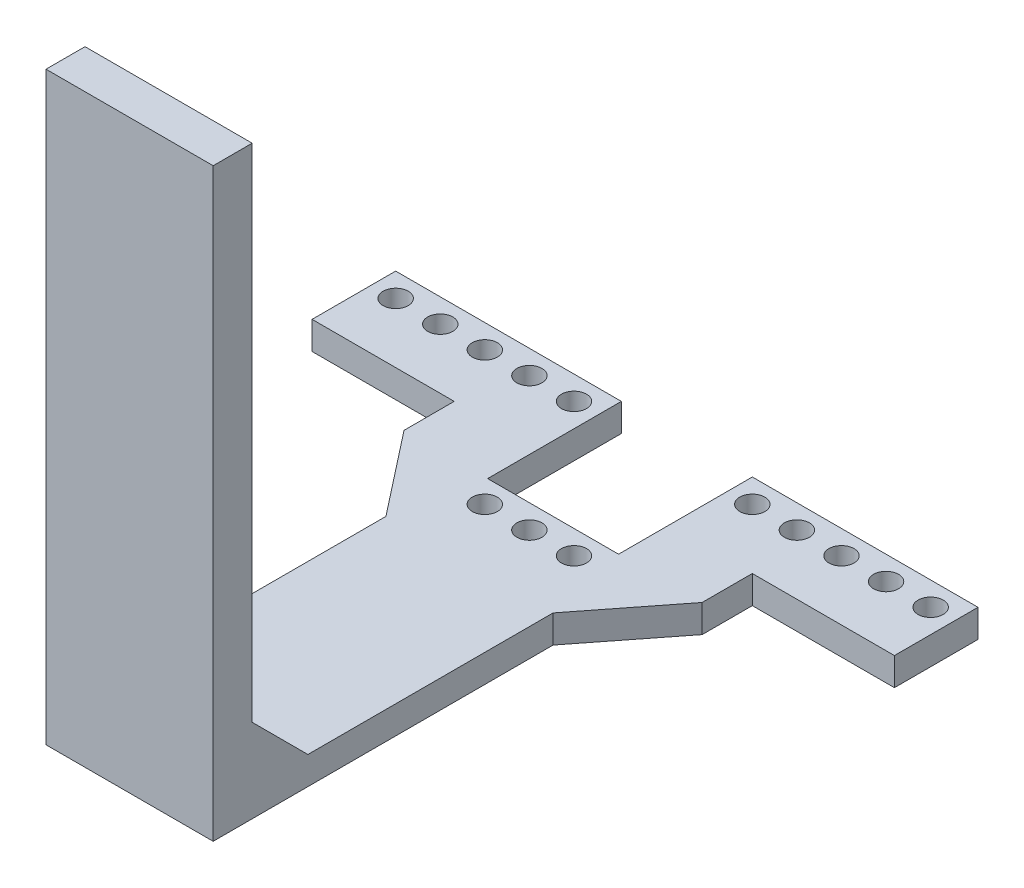
from build123d import *

# Parameters (mm, degrees)
SKETCH_2_R      = 2.25
EXTRUDE_1_DEPTH = 5
SKETCH_9_W      = 30
SKETCH_9_H      = 7
EXTRUDE_8_DEPTH = 100
CHAMFER_1_SIZE  = 10


with BuildPart() as part:
    # 草图2 → 凸台-拉伸1 (new body)
    with BuildSketch(Plane(origin=(0, 0, 0), x_dir=(1, 0, 0), z_dir=(0, 1, 0))):
        Polygon((-11.75, 45), (-52.25, 45), (-52.25, 30), (-26.75, 30), (-26.75, 21), (-15, 6), (-15, -55), (15, -55), (15, 6), (26.75, 21), (26.75, 30), (52.25, 30), (52.25, 45), (11.75, 45), (11.75, 21), (-11.75, 21), align=None)
        with Locations((-8, 16.75)):
            Circle(SKETCH_2_R, mode=Mode.SUBTRACT)
        with Locations((-48, 40.75)):
            Circle(SKETCH_2_R, mode=Mode.SUBTRACT)
        with Locations((-40, 40.75)):
            Circle(SKETCH_2_R, mode=Mode.SUBTRACT)
        with Locations((-32, 40.75)):
            Circle(SKETCH_2_R, mode=Mode.SUBTRACT)
        with Locations((-24, 40.75)):
            Circle(SKETCH_2_R, mode=Mode.SUBTRACT)
        with Locations((-16, 40.75)):
            Circle(SKETCH_2_R, mode=Mode.SUBTRACT)
        with Locations((0, 16.75)):
            Circle(SKETCH_2_R, mode=Mode.SUBTRACT)
        with Locations((8, 16.75)):
            Circle(SKETCH_2_R, mode=Mode.SUBTRACT)
        with Locations((16, 40.75)):
            Circle(SKETCH_2_R, mode=Mode.SUBTRACT)
        with Locations((24, 40.75)):
            Circle(SKETCH_2_R, mode=Mode.SUBTRACT)
        with Locations((32, 40.75)):
            Circle(SKETCH_2_R, mode=Mode.SUBTRACT)
        with Locations((40, 40.75)):
            Circle(SKETCH_2_R, mode=Mode.SUBTRACT)
        with Locations((48, 40.75)):
            Circle(SKETCH_2_R, mode=Mode.SUBTRACT)
    extrude(amount=EXTRUDE_1_DEPTH)

    # 草图9 → 凸台-拉伸8 (add)
    with BuildSketch(Plane(origin=(0, 5, 0), x_dir=(1, 0, 0), z_dir=(0, 1, 0))):
        with Locations((0, -51.5)):
            Rectangle(SKETCH_9_W, SKETCH_9_H)
    extrude(amount=EXTRUDE_8_DEPTH)

    # 倒角1
    chamfer_1_edges = [part.edges().sort_by_distance(p)[0] for p in [
        (0, 5, 48),
    ]]
    chamfer(chamfer_1_edges, length=CHAMFER_1_SIZE)


solid = part.part
